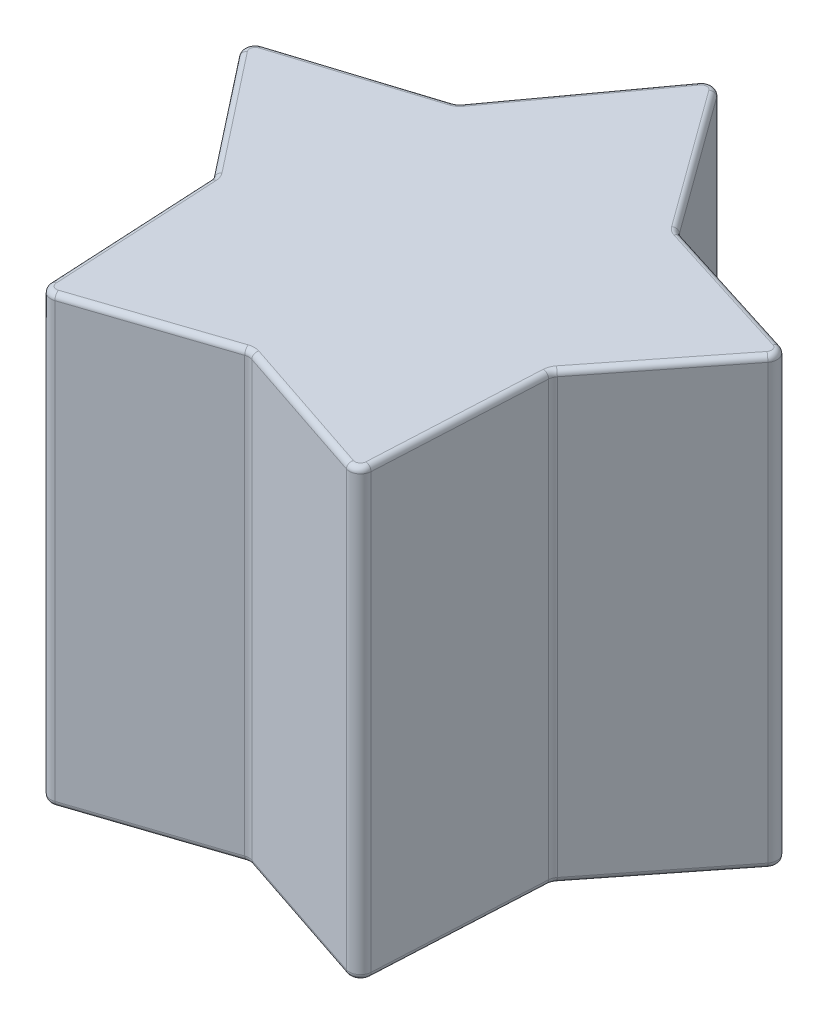
from build123d import *

# Parameters (mm, degrees)
BOSS_EXTRUDE2_DEPTH = 40
FILLET1_R           = 0.5


with BuildPart() as part:
    # Sketch2 → Boss-Extrude2 (new body)
    with BuildSketch(Plane(origin=(0, 0, 0), x_dir=(1, 0, 0), z_dir=(0, 1, 0))):
        with BuildLine():
            Line((-11.968421327, -2.254762689), (-12.768130116, 12.934389424))
            ThreePointArc((-12.768130116, 12.934389424), (-12.830483223, 13.233110098), (-12.980023038, 13.499117232))
            Line((-12.980023038, 13.499117232), (-21.30528594, 24.109243262))
            ThreePointArc((-21.30528594, 24.109243262), (-21.474074954, 25.021497378), (-20.820456545, 25.679889569))
            Line((-20.820456545, 25.679889569), (-7.820456545, 29.796598877))
            ThreePointArc((-7.820456545, 29.796598877), (-7.538331995, 29.938200284), (-7.314402157, 30.160687693))
            Line((-7.314402157, 30.160687693), (1.648240391, 42.449744395))
            ThreePointArc((1.648240391, 42.449744395), (2.456805306, 42.860491696), (3.264863583, 42.448748585))
            Line((3.264863583, 42.448748585), (12.215581245, 30.144230896))
            ThreePointArc((12.215581245, 30.144230896), (12.440286125, 29.920711908), (12.723652494, 29.778738241))
            Line((12.723652494, 29.778738241), (25.72921648, 25.679640665))
            ThreePointArc((25.72921648, 25.679640665), (26.384239629, 25.020473465), (26.214025384, 24.106917864))
            Line((26.214025384, 24.106917864), (17.864638162, 13.512427533))
            ThreePointArc((17.864638162, 13.512427533), (17.713821982, 13.24484697), (17.651334127, 12.944114289))
            Line((17.651334127, 12.944114289), (16.880505405, -2.25201434))
            ThreePointArc((16.880505405, -2.25201434), (16.4453587, -3.027422967), (15.564647844, -3.149732332))
            Line((15.564647844, -3.149732332), (2.774377184, 1.127387402))
            ThreePointArc((2.774377184, 1.127387402), (2.457235569, 1.17900921), (2.140093955, 1.127387402))
            Line((2.140093955, 1.127387402), (-10.652662849, -3.150563709))
            ThreePointArc((-10.652662849, -3.150563709), (-11.532580614, -3.028794858), (-11.968421327, -2.254762689))
        make_face()
    extrude(amount=BOSS_EXTRUDE2_DEPTH)

    # Fillet1
    fillet1_edges = [part.edges().sort_by_distance(p)[0] for p in [
        (-14.320456545, 0, -27.738244223),
        (-21.474074954, 0, -25.021497378),
        (-17.142654489, 0, -18.804180247),
        (-12.830483223, 0, -13.233110098),
        (-12.368275721, 0, -5.339813367),
        (-11.532580614, 0, 3.028794858),
        (-4.256284447, 0, 1.011588153),
        (2.457235569, 0, -1.17900921),
        (9.169512514, 0, 1.011172465),
        (16.4453587, 0, 3.027422967),
        (17.265919766, 0, -5.346049974),
        (17.713821982, 0, -13.24484697),
        (22.039331773, 0, -18.809672699),
        (26.384239629, 0, -25.020473465),
        (19.226434487, 0, -27.729189453),
        (12.440286125, 0, -29.920711908),
        (7.740222414, 0, -36.296489741),
        (2.456805306, 0, -42.860491696),
        (-2.833080883, 0, -36.305216044),
        (-7.538331995, 0, -29.938200284),
        (-2.833080883, 40, -36.305216044),
        (2.456805306, 40, -42.860491696),
        (7.740222414, 40, -36.296489741),
        (12.440286125, 40, -29.920711908),
        (19.226434487, 40, -27.729189453),
        (26.384239629, 40, -25.020473465),
        (22.039331773, 40, -18.809672699),
        (17.713821982, 40, -13.24484697),
        (17.265919766, 40, -5.346049974),
        (16.4453587, 40, 3.027422967),
        (9.169512514, 40, 1.011172465),
        (2.457235569, 40, -1.17900921),
        (-4.256284447, 40, 1.011588153),
        (-11.532580614, 40, 3.028794858),
        (-12.368275721, 40, -5.339813367),
        (-12.830483223, 40, -13.233110098),
        (-17.142654489, 40, -18.804180247),
        (-21.474074954, 40, -25.021497378),
        (-14.320456545, 40, -27.738244223),
        (-7.538331995, 40, -29.938200284),
    ]]
    fillet(fillet1_edges, radius=FILLET1_R)


solid = part.part
